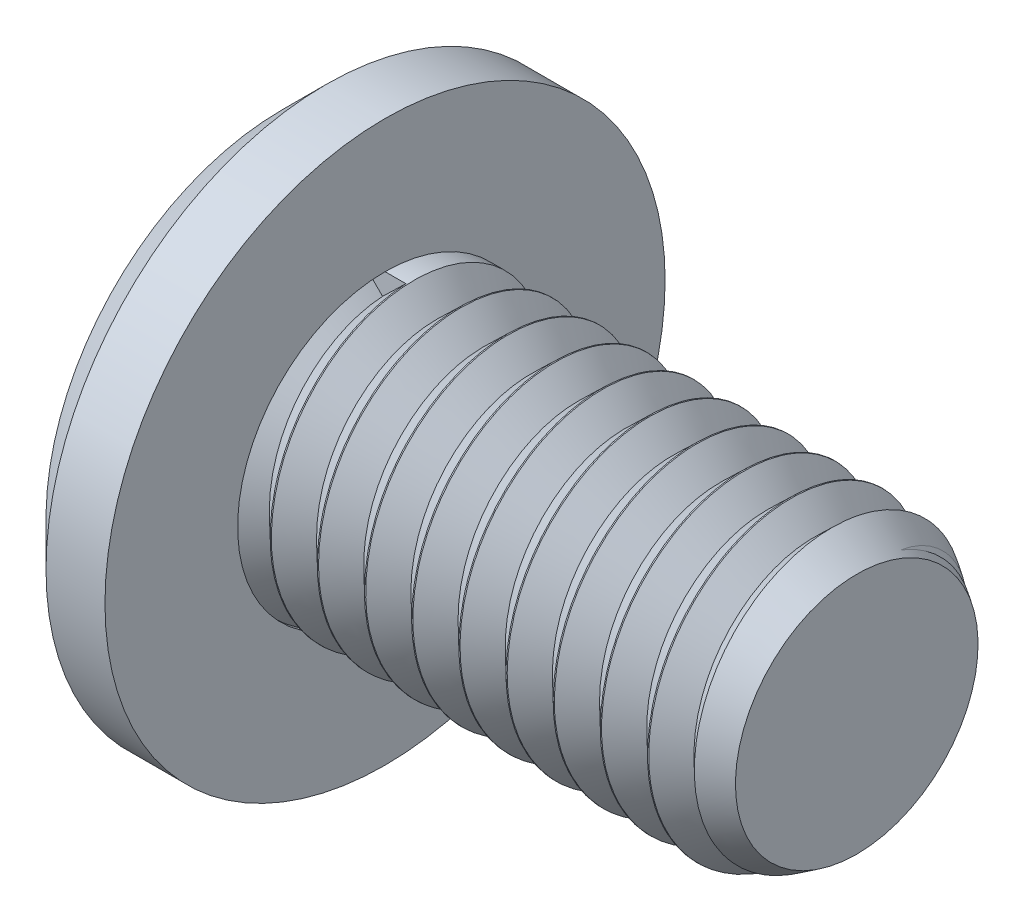
from build123d import *

# Parameters (mm, degrees)
CUT_SWEEP2_PITCH   = 0.8
CUT_EXTRUDE1_DEPTH = 1
CHAMFER1_SIZE      = 0.75


with BuildPart() as part:
    # Sketch1 → Revolve1 (revolve)
    with BuildSketch(Plane.XY, mode=Mode.PRIVATE) as revolve1_sk:
        Polygon((9.75, 0), (9.75, 2.057236169), (9.055, 2.5), (1.75, 2.5), (1.75, 4.75), (0, 4.75), (0, 0), align=None)
    revolve(revolve1_sk.sketch.rotate(Axis((0, 0, 0), (1, 0, 0)), 180), axis=Axis((0, 0, 0), (1, 0, 0)))

    # Cut-Sweep2: arcs per turn and ends read off the stored shape
    # Cut-Sweep2: the profile of Sketch4 profile screwed along a right-hand helix through 31 turns, 8 arcs to a turn; built about Z, then put on its axis
    cut_sweep2_z = Axis((0, 0, 0), (0, 0, 1))
    cut_sweep2_corners = [(2.5003, 0, 0.354662464), (2.5003, 0, -0.425947684), (2.116486975, 0, -0.04213466)]
    with BuildLine(mode=Mode.PRIVATE) as cut_sweep2_profile:
        Line(cut_sweep2_corners[0], cut_sweep2_corners[1])
        Line(cut_sweep2_corners[1], cut_sweep2_corners[2])
        Line(cut_sweep2_corners[2], cut_sweep2_corners[0])
    cut_sweep2_cap = Face(cut_sweep2_profile.wire())
    cut_sweep2_turn_angles = [0, 22.5, 45, 67.5, 90, 112.5, 135, 157.5, 180, 202.5, 225, 247.5, 270, 292.5, 315, 337.5, 360]
    cut_sweep2_turn_weights = [1, 0.9238795325112867, 1, 0.9238795325112867, 1, 0.9238795325112867, 1, 0.9238795325112867, 1, 0.9238795325112867, 1, 0.9238795325112867, 1, 0.9238795325112867, 1, 0.9238795325112867, 1]
    cut_sweep2_turn_rails = [Edge.make_bspline([Vector(p[0], p[1], 0).rotate(cut_sweep2_z, cut_sweep2_turn_angles[k]) / cut_sweep2_turn_weights[k] + Vector(0, 0, p[2] + CUT_SWEEP2_PITCH * cut_sweep2_turn_angles[k] / 360) for k in range(17)], [0, 0, 0, 1, 1, 2, 2, 3, 3, 4, 4, 5, 5, 6, 6, 7, 7, 8, 8, 8], 2, cut_sweep2_turn_weights) for p in cut_sweep2_corners]
    cut_sweep2_turn_sides = [Face.make_surface_from_curves(cut_sweep2_turn_rails[p[0]], cut_sweep2_turn_rails[p[1]]) for p in [(0, 1), (1, 2), (2, 0)]]
    cut_sweep2 = Plane(origin=(1.75, 0, 0), x_dir=(0, 1, 0), z_dir=(1, 0, 0)) * Solid(Shell([*[p.moved(Location((0, 0, CUT_SWEEP2_PITCH * i))) for i in range(31) for p in cut_sweep2_turn_sides], cut_sweep2_cap, cut_sweep2_cap.rotate(cut_sweep2_z, 11160).moved(Location((0, 0, CUT_SWEEP2_PITCH * 11160 / 360)))]))
    add(cut_sweep2, mode=Mode.SUBTRACT)

    # Sketch5 → Cut-Extrude1 (cut)
    with BuildSketch(Plane.ZY):
        Polygon((1.5, -0.866025404), (1.5, 0.866025404), (0, 1.732050808), (-1.5, 0.866025404), (-1.5, -0.866025404), (0, -1.732050808), align=None)
    extrude(amount=-CUT_EXTRUDE1_DEPTH, mode=Mode.SUBTRACT)

    # Chamfer1
    chamfer1_edges = [part.edges().sort_by_distance(p)[0] for p in [
        (0, 4.75, 0),
    ]]
    chamfer(chamfer1_edges, length=CHAMFER1_SIZE)


solid = part.part
